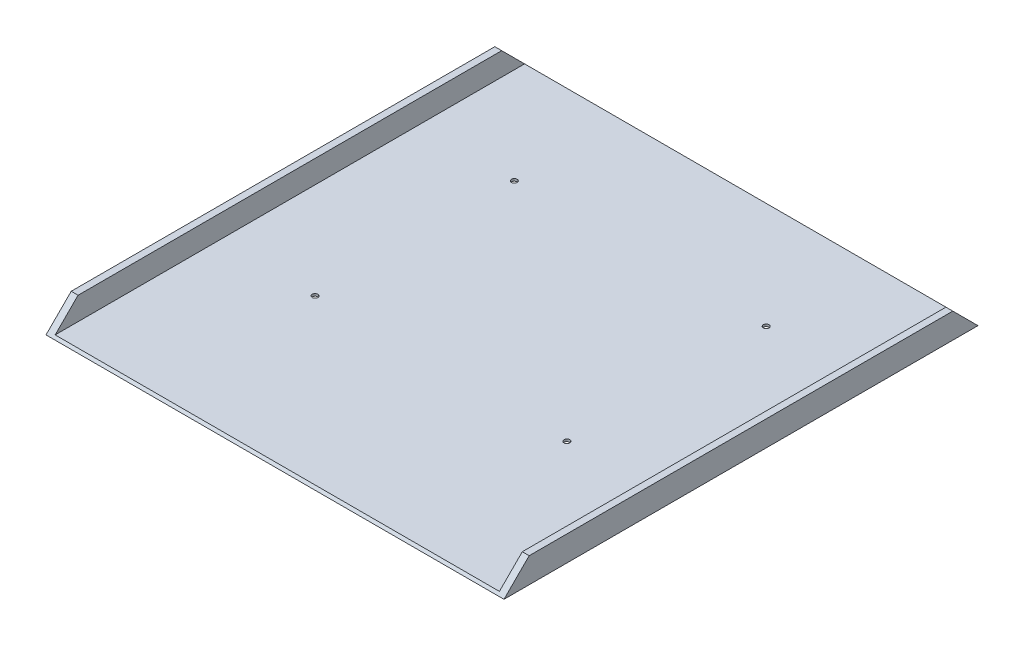
from build123d import *

# Parameters (mm, degrees)
SKETCH1_W           = 200
SKETCH1_H           = 225
SKETCH1_R           = 1.25
BOSS_EXTRUDE1_DEPTH = 1
SKETCH2_W           = 3
SKETCH2_H           = 225
BOSS_EXTRUDE2_DEPTH = 10


with BuildPart() as part:
    # Sketch1 → Boss-Extrude1 (new body)
    with BuildSketch(Plane(origin=(0, 0, 0), x_dir=(1, 0, 0), z_dir=(0, 1, 0))):
        with Locations((100, -112.5)):
            Rectangle(SKETCH1_W, SKETCH1_H)
        with Locations(Location((45, -56.5, 0), (0, 0, 270))):
            Circle(SKETCH1_R, mode=Mode.SUBTRACT)
        with Locations(Location((155, -56.5, 0), (0, 0, 90))):
            Circle(SKETCH1_R, mode=Mode.SUBTRACT)
        with Locations(Location((45, -143.5, 0), (0, 0, 270))):
            Circle(SKETCH1_R, mode=Mode.SUBTRACT)
        with Locations(Location((155, -143.5, 0), (0, 0, 90))):
            Circle(SKETCH1_R, mode=Mode.SUBTRACT)
    extrude(amount=BOSS_EXTRUDE1_DEPTH)

    # Sketch2 → Boss-Extrude2 (add)
    with BuildSketch(Plane(origin=(0, 1, 0), x_dir=(1, 0, 0), z_dir=(0, 1, 0))):
        with Locations((1.5, -112.5)):
            Rectangle(SKETCH2_W, SKETCH2_H)
        with Locations((198.5, -112.5)):
            Rectangle(SKETCH2_W, SKETCH2_H)
    extrude(amount=BOSS_EXTRUDE2_DEPTH)

    # Chamfer7
    # the kernel refuses this chamfer: 20 mm, written as the material it takes off along each edge
    with BuildSketch(Plane(origin=(-123.440783422, 11, 0), x_dir=(0, -0.9996219169112968, -0.027495876610586372), z_dir=(1, 0, 0))) as chamfer7_piece_1:
        with BuildLine():
            Line((20.573463904, 0), (-1.130943098, -20.54235587))
            Line((-1.130943098, -20.54235587), (-1.530791864, -20.53135752))
            ThreePointArc((-1.530791864, -20.53135752), (-0.682584541, -10.267956593), (-0.399848767, 0.010998351))
            Line((-0.399848767, 0.010998351), (0.010998351, 0.399848767))
            ThreePointArc((0.010998351, 0.399848767), (10.289953294, 0.117112992), (20.584462254, 0.399848767))
            Line((20.584462254, 0.399848767), (20.573463904, 0))
        make_face()
    extrude(amount=249.881566845, mode=Mode.SUBTRACT)
    with BuildSketch(Plane(origin=(323.440783422, 11, 0), x_dir=(0, -0.9996219169112968, -0.027495876610586372), z_dir=(-1, 0, 0))) as chamfer7_piece_2:
        with BuildLine():
            Line((20.573463904, 0), (-1.130943098, 20.54235587))
            Line((-1.130943098, 20.54235587), (-1.530791864, 20.53135752))
            ThreePointArc((-1.530791864, 20.53135752), (-0.682584541, 10.267956593), (-0.399848767, -0.010998351))
            Line((-0.399848767, -0.010998351), (0.010998351, -0.399848767))
            ThreePointArc((0.010998351, -0.399848767), (10.289953294, -0.117112992), (20.584462254, -0.399848767))
            Line((20.584462254, -0.399848767), (20.573463904, 0))
        make_face()
    extrude(amount=249.881566845, mode=Mode.SUBTRACT)

    # Chamfer8
    # the kernel refuses this chamfer: 20 mm, written as the material it takes off along each edge
    with BuildSketch(Plane(origin=(126.440783422, 11, 225), x_dir=(0, 0.027495876610586403, -0.9996219169112968), z_dir=(-1, 0, 0))) as chamfer8_piece_1:
        with BuildLine():
            Line((20.573463904, 0), (-1.130943098, 20.54235587))
            Line((-1.130943098, 20.54235587), (-1.530791864, 20.53135752))
            ThreePointArc((-1.530791864, 20.53135752), (-0.682584541, 10.267956593), (-0.399848767, -0.010998351))
            Line((-0.399848767, -0.010998351), (0.010998351, -0.399848767))
            ThreePointArc((0.010998351, -0.399848767), (10.289953294, -0.117112992), (20.584462254, -0.399848767))
            Line((20.584462254, -0.399848767), (20.573463904, 0))
        make_face()
    extrude(amount=249.881566845, mode=Mode.SUBTRACT)
    with BuildSketch(Plane(origin=(73.559216578, 11, 225), x_dir=(0, 0.027495876610586403, -0.9996219169112968), z_dir=(1, 0, 0))) as chamfer8_piece_2:
        with BuildLine():
            Line((20.573463904, 0), (-1.130943098, -20.54235587))
            Line((-1.130943098, -20.54235587), (-1.530791864, -20.53135752))
            ThreePointArc((-1.530791864, -20.53135752), (-0.682584541, -10.267956593), (-0.399848767, 0.010998351))
            Line((-0.399848767, 0.010998351), (0.010998351, 0.399848767))
            ThreePointArc((0.010998351, 0.399848767), (10.289953294, 0.117112992), (20.584462254, 0.399848767))
            Line((20.584462254, 0.399848767), (20.573463904, 0))
        make_face()
    extrude(amount=249.881566845, mode=Mode.SUBTRACT)


solid = part.part
